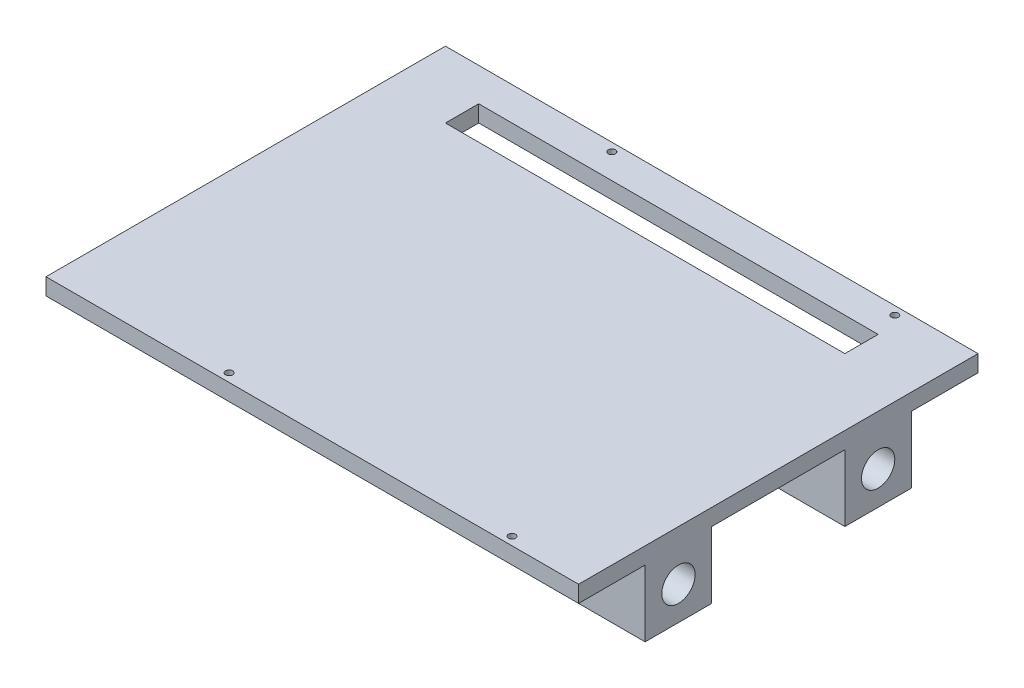
from build123d import *

# Parameters (mm, degrees)
SKETCH2_W                 = 203.2
SKETCH2_H                 = 152.4
BOSS_EXTRUDE1_DEPTH       = 6.35
SKETCH3_W                 = 152.4
SKETCH3_H                 = 12.7
CUT_EXTRUDE1_DEPTH        = 6.35
SKETCH4_W                 = 50.8
SKETCH4_H                 = 25.4
BOSS_EXTRUDE2_DEPTH       = 25.4
SKETCH7_R                 = 6.35
CUT_EXTRUDE2_DEPTH        = 50.8
CUT_EXTRUDE3_START        = -50.8
SKETCH8_R                 = 6.35
CUT_EXTRUDE3_DEPTH        = 50.8
F_6_32_TAPPED_HOLE1_D     = 2.7051
F_6_32_TAPPED_HOLE1_DEPTH = 12.7
F_6_32_TAPPED_HOLE1_TIP   = 0.81269403


with BuildPart() as part:
    # Sketch2 → Boss-Extrude1 (new body)
    with BuildSketch(Plane(origin=(0, 0, 0), x_dir=(1, 0, 0), z_dir=(0, 1, 0))):
        Rectangle(SKETCH2_W, SKETCH2_H)
    extrude(amount=BOSS_EXTRUDE1_DEPTH)

    # Sketch3 → Cut-Extrude1 (cut)
    with BuildSketch(Plane(origin=(0, 6.35, 0), x_dir=(1, 0, 0), z_dir=(0, 1, 0))):
        with Locations((0, 57.15)):
            Rectangle(SKETCH3_W, SKETCH3_H)
    extrude(amount=-CUT_EXTRUDE1_DEPTH, mode=Mode.SUBTRACT)

    # Sketch4 → Boss-Extrude2 (add)
    with BuildSketch(Plane.XZ):
        with Locations((-76.2, 38.1)):
            Rectangle(SKETCH4_W, SKETCH4_H)
        with Locations((76.2, 38.1)):
            Rectangle(SKETCH4_W, SKETCH4_H)
        with Locations((76.2, -38.1)):
            Rectangle(SKETCH4_W, SKETCH4_H)
        with Locations((-76.2, -38.1)):
            Rectangle(SKETCH4_W, SKETCH4_H)
    extrude(amount=BOSS_EXTRUDE2_DEPTH)

    # Sketch7 → Cut-Extrude2 (cut)
    with BuildSketch(Plane.ZY.offset(101.6)):
        with Locations((-38.1, -12.7)):
            Circle(SKETCH7_R)
        with Locations((38.1, -12.7)):
            Circle(SKETCH7_R)
    extrude(amount=-CUT_EXTRUDE2_DEPTH, mode=Mode.SUBTRACT)

    # Sketch8 → Cut-Extrude3 (cut)
    with BuildSketch(Plane(origin=(101.6, 0, 0), x_dir=(0, 0, -1), z_dir=(1, 0, 0)).offset(CUT_EXTRUDE3_START)):
        with Locations((-38.1, -12.7)):
            Circle(SKETCH8_R)
        with Locations((38.1, -12.7)):
            Circle(SKETCH8_R)
    extrude(amount=CUT_EXTRUDE3_DEPTH, mode=Mode.SUBTRACT)

    # #6-32 Tapped Hole1
    with Locations(Plane(origin=(0, 6.35, 0), x_dir=(1, 0, 0), z_dir=(0, 1, 0))):
        with Locations((-34.925, -73.025), (-34.925, 73.025), (73.025, 73.025), (73.025, -73.025)):
            Hole(F_6_32_TAPPED_HOLE1_D / 2, depth=F_6_32_TAPPED_HOLE1_DEPTH)
            with Locations((0, 0, -(F_6_32_TAPPED_HOLE1_DEPTH + F_6_32_TAPPED_HOLE1_TIP / 2))):  # 118° drill point
                Cone(0, F_6_32_TAPPED_HOLE1_D / 2, F_6_32_TAPPED_HOLE1_TIP, mode=Mode.SUBTRACT)


solid = part.part
